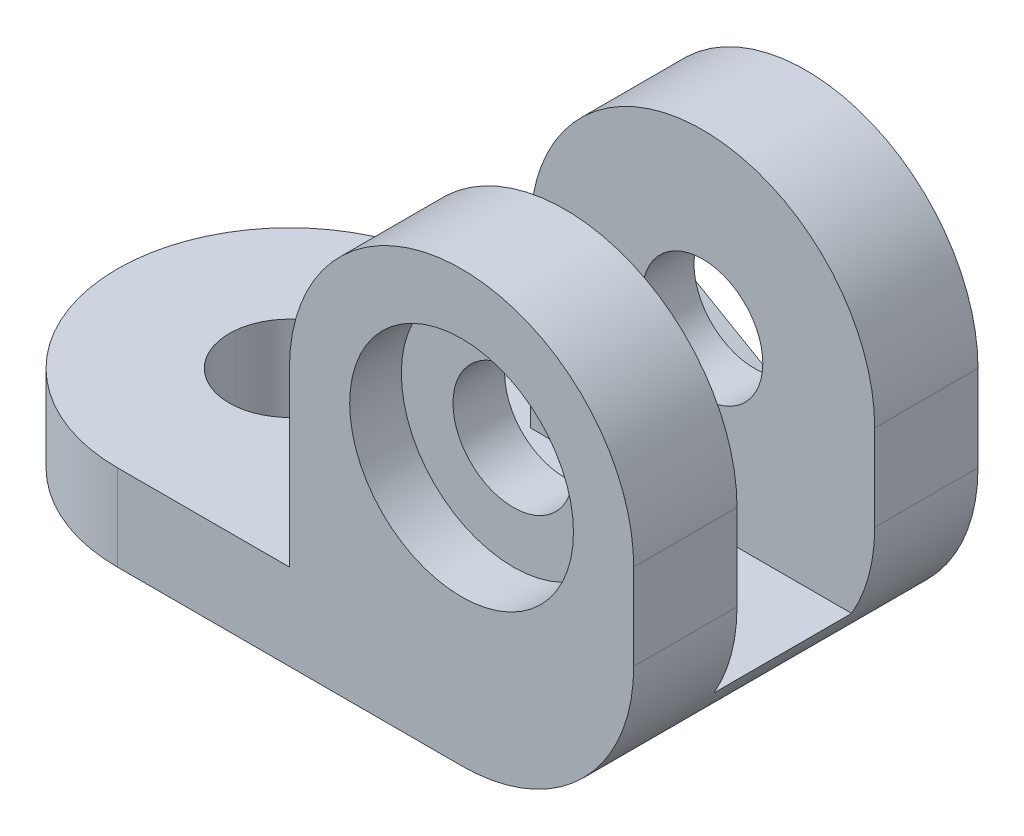
from build123d import *

# Parameters (mm, degrees)
ESBO_O1_R                  = 5
ESBO_O1_R_2                = 1.75
RESSALTO_EXTRUS_O1_DEPTH   = 10
ESBO_O2_W                  = 10
ESBO_O2_H                  = 2.5
RESSALTO_EXTRUS_O2_DEPTH   = 20
CORTE_EXTRUS_O1_DEPTH      = 15
CORTE_EXTRUS_O1_DEPTH_BACK = 14
ESBO_O3_R                  = 1.75
CORTE_EXTRUS_O3_DEPTH      = 12
CORTE_EXTRUS_O3_DEPTH_BACK = 14
ESBO_O5_W                  = 4
ESBO_O5_H                  = 14.425539271
FILETE1_R                  = 5
FILETE2_R                  = 5
CORTE_EXTRUS_O4_DEPTH      = 1.5
ESBO_O7_R                  = 3.25
CORTE_EXTRUS_O5_DEPTH      = 1.5


# Some blends are built 0.0001 mm under size
with BuildPart() as part:
    # Esboço1 → Ressalto-extrusão1 (new body)
    # profile 1 of 3: a face of its own
    with BuildSketch(Plane.XY):
        with BuildLine():
            ThreePointArc((0, -5), (-3.535533906, -3.535533906), (-5, 0))
            Line((-5, 0), (-5, -5))
            Line((-5, -5), (0, -5))
        make_face()
    # profile 2 of 3: a face of its own
    with BuildSketch(Plane.XY):
        Circle(ESBO_O1_R)
        Circle(ESBO_O1_R_2, mode=Mode.SUBTRACT)
    # profile 3 of 3: a face of its own
    with BuildSketch(Plane.XY):
        with BuildLine():
            Line((5, -5), (5, 0))
            ThreePointArc((5, 0), (3.535533906, -3.535533906), (0, -5))
            Line((0, -5), (5, -5))
        make_face()
    extrude(amount=RESSALTO_EXTRUS_O1_DEPTH)

    # Esboço2 → Ressalto-extrusão2 (add)
    with BuildSketch(Plane(origin=(5, 0, 5), x_dir=(0, 0, 1), z_dir=(-1, 0, 0))):
        with Locations((0, -6.25)):
            Rectangle(ESBO_O2_W, ESBO_O2_H)
    extrude(amount=RESSALTO_EXTRUS_O2_DEPTH)

    # Esboço3 → Corte-extrusão1 (cut, two sides: drawn at the far end of the back side and taken through both)
    with BuildSketch(Plane.XZ.offset(5).offset(-CORTE_EXTRUS_O1_DEPTH_BACK)):
        with Locations((-10, 5)):
            Circle(ESBO_O3_R)
    extrude(amount=CORTE_EXTRUS_O1_DEPTH + CORTE_EXTRUS_O1_DEPTH_BACK, mode=Mode.SUBTRACT)

    # Esboço5 → Corte-extrusão3 (cut, two sides: drawn at the far end of the back side and taken through both)
    with BuildSketch(Plane.ZY.offset(5).offset(-CORTE_EXTRUS_O3_DEPTH_BACK)):
        with Locations((5, 2.212769635)):
            Rectangle(ESBO_O5_W, ESBO_O5_H)
    extrude(amount=CORTE_EXTRUS_O3_DEPTH + CORTE_EXTRUS_O3_DEPTH_BACK, mode=Mode.SUBTRACT)

    # Filete1
    filete1_edges = [part.edges().sort_by_distance(p)[0] for p in [
        (-15, -6.25, 10),
        (-15, -6.25, 0),
    ]]
    fillet(filete1_edges, radius=FILETE1_R - 0.0001)  # a hair under: the kernel refuses the full size

    # Filete2
    # the kernel refuses this fillet: 5 mm, written as the material it takes off along each edge
    with BuildSketch(Plane(origin=(5, -7.5, 22.5), x_dir=(-1, 0, 0), z_dir=(0, 0, -1))) as filete2_piece_1:
        with BuildLine():
            CenterArc((FILETE2_R, FILETE2_R), FILETE2_R, 180, 90)
            Line((0, FILETE2_R), (0, 0))
            Line((0, 0), (FILETE2_R, 0))
        make_face()
    extrude(amount=35, mode=Mode.SUBTRACT)

    # Esboço6 → Corte-extrusão4 (cut)
    with BuildSketch(Plane(origin=(0, 0, 0), x_dir=(-1, 0, 0), z_dir=(0, 0, -1))):
        Polygon((0, 3.75277675), (-3.25, 1.876388375), (-3.25, -1.876388375), (0, -3.75277675), (3.25, -1.876388375), (3.25, 1.876388375), align=None)
    extrude(amount=-CORTE_EXTRUS_O4_DEPTH, mode=Mode.SUBTRACT)

    # Esboço7 → Corte-extrusão5 (cut)
    with BuildSketch(Plane.XY.offset(10)):
        Circle(ESBO_O7_R)
    extrude(amount=-CORTE_EXTRUS_O5_DEPTH, mode=Mode.SUBTRACT)


solid = part.part
